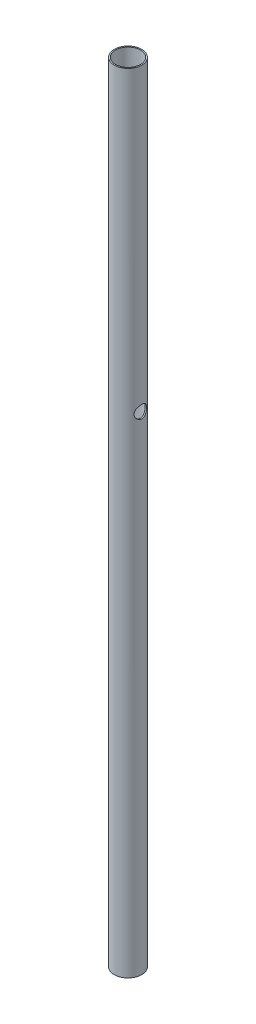
from build123d import *

# Parameters (mm, degrees)
SKETCH_2_R               = 11
SKETCH_2_R_2             = 10
CUT_EXTRUDE_1_DEPTH      = 631.192034224
CUT_EXTRUDE_1_DEPTH_BACK = 631.192034224
SKETCH_3_R               = 5


with BuildPart() as part:
    # По траектории1: sweep along a path in Эскиз1
    with BuildLine(Plane.XY) as sweep_1_path:
        Line((0, 0), (0, -630))
    # Эскиз2 → По траектории1 (sweep)
    with BuildSketch(Plane(origin=(0, 0, 0), x_dir=(1, 0, 0), z_dir=(0, 1, 0))):
        Circle(SKETCH_2_R)
        Circle(SKETCH_2_R_2, mode=Mode.SUBTRACT)
    sweep(path=sweep_1_path.line)

    # Эскиз3 → Вырез-Вытянуть1 (cut, two sides: drawn at the far end of the back side and taken through both)
    with BuildSketch(Plane(origin=(0, 0, 0), x_dir=(0, 0, -1), z_dir=(1, 0, 0)).offset(-CUT_EXTRUDE_1_DEPTH_BACK)):
        with Locations((0, -240)):
            Circle(SKETCH_3_R)
    extrude(amount=CUT_EXTRUDE_1_DEPTH + CUT_EXTRUDE_1_DEPTH_BACK, mode=Mode.SUBTRACT)


solid = part.part
